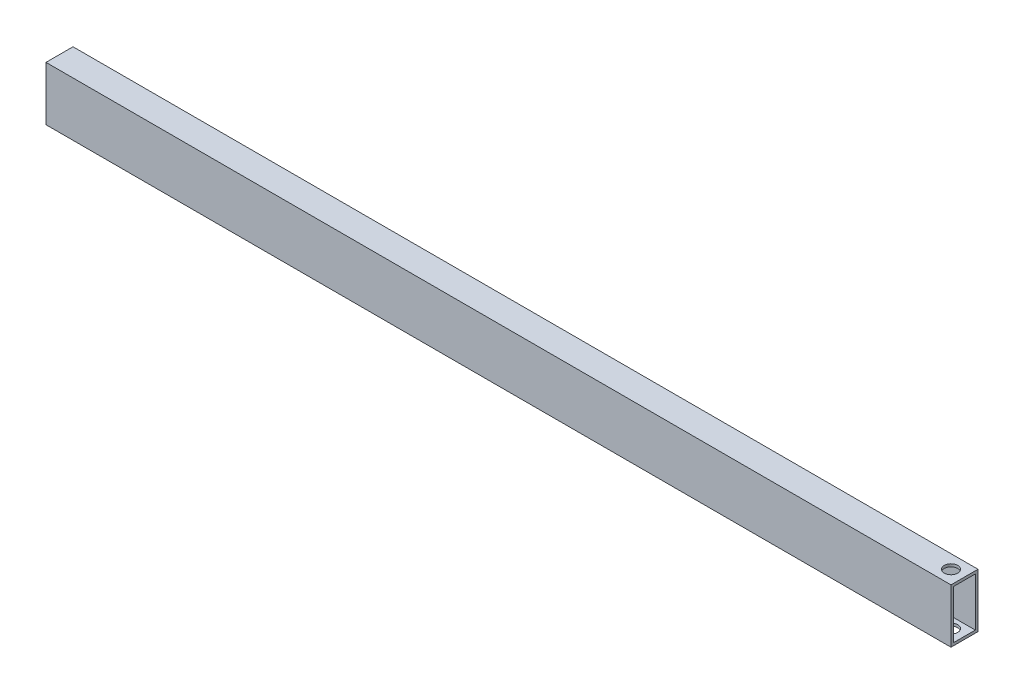
from build123d import *

# Parameters (mm, degrees)
BOSS_EXTRUDE1_DEPTH      = 225
BOSS_EXTRUDE1_DEPTH_BACK = 110
SKETCH1_W                = 10
SKETCH1_H                = 20
SKETCH1_W_2              = 8
SKETCH1_H_2              = 18
SKETCH3_R                = 2.5
CUT_EXTRUDE1_DEPTH       = 1
SKETCH4_R                = 2.5
CUT_EXTRUDE2_DEPTH       = 20


with BuildPart() as part:
    # Sketch1 → Boss-Extrude1 (new, two sides: drawn at the far end of the back side and taken through both)
    with BuildSketch(Plane(origin=(0, 0, 0), x_dir=(0, 0, -1), z_dir=(1, 0, 0)).offset(-BOSS_EXTRUDE1_DEPTH_BACK)):
        with Locations((0, 3.989361702)):
            Rectangle(SKETCH1_W, SKETCH1_H)
        with Locations((0, 3.989361702)):
            Rectangle(SKETCH1_W_2, SKETCH1_H_2, mode=Mode.SUBTRACT)
    extrude(amount=BOSS_EXTRUDE1_DEPTH + BOSS_EXTRUDE1_DEPTH_BACK)

    # Sketch3 → Cut-Extrude1 (cut)
    with BuildSketch(Plane(origin=(0, 0, -5), x_dir=(-1, 0, 0), z_dir=(0, 0, -1))):
        with Locations((-19.85, 3.989361702)):
            Circle(SKETCH3_R)
        with Locations((-10, 3.989361702)):
            Circle(SKETCH3_R)
        with Locations((0, 3.989361702)):
            Circle(SKETCH3_R)
        with Locations((10, 3.989361702)):
            Circle(SKETCH3_R)
        with Locations((19.85, 3.989361702)):
            Circle(SKETCH3_R)
    extrude(amount=-CUT_EXTRUDE1_DEPTH, mode=Mode.SUBTRACT)

    # Sketch4 → Cut-Extrude2 (cut)
    with BuildSketch(Plane(origin=(0, 13.989361702, 0), x_dir=(1, 0, 0), z_dir=(0, 1, 0))):
        with Locations((220, 0)):
            Circle(SKETCH4_R)
    extrude(amount=-CUT_EXTRUDE2_DEPTH, mode=Mode.SUBTRACT)


solid = part.part
